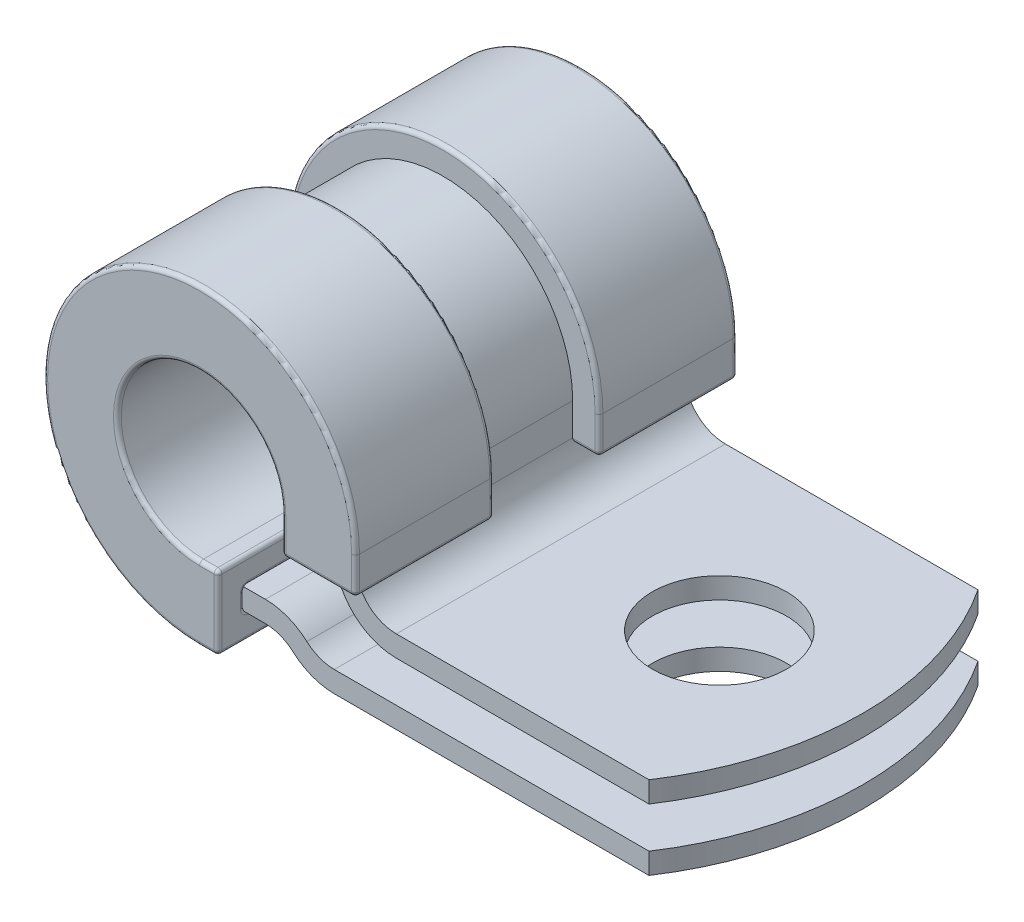
from build123d import *

# Parameters (mm, degrees)
BOSS_EXTRUDE1_DEPTH         = 6.35
FILLET3_R                   = 1.5748
FILLET2_R                   = 2.3876
SKETCH2_R                   = 2.5908
CUT_EXTRUDE1_DEPTH          = 21.22760381
CUT_EXTRUDE3_DEPTH          = 21.22760381
CUT_EXTRUDE3_DEPTH_BACK     = 21.22760381
BOSS_EXTRUDE2_DEPTH         = 7.366
BOSS_EXTRUDE2_DEPTH_BACK    = 7.366
BODY_MOVE_COPY1_START       = -6.0198
BODY_MOVE_COPY1_OUTLINE_R   = 2.5908
BODY_MOVE_COPY1_DEPTH       = 0.8128
BODY_MOVE_COPY1_START_2     = -1.2446
BODY_MOVE_COPY1_2_OUTLINE_W = 0.8128
BODY_MOVE_COPY1_2_OUTLINE_H = 12.7
BODY_MOVE_COPY1_2_DEPTH     = 1.2446
BODY_MOVE_COPY1_3_OUTLINE_R = 2.5908
BODY_MOVE_COPY1_3_DEPTH     = 4.191
BODY_MOVE_COPY1_START_3     = -3.6322
BODY_MOVE_COPY1_4_OUTLINE_R = 2.5908
BODY_MOVE_COPY1_4_DEPTH     = 2.3876
BODY_MOVE_COPY1_START_4     = -6.35
BODY_MOVE_COPY1_5_DEPTH     = 12.7
BODY_MOVE_COPY1_6_DEPTH     = 12.7
CUT_EXTRUDE4_DEPTH          = 2.032
CUT_EXTRUDE4_DEPTH_BACK     = 2.032
FILLET1_R                   = 0.1524


with BuildPart() as part:
    # Sketch8 → Boss-Extrude1 (new, symmetric)
    with BuildSketch(Plane.XY):
        with BuildLine():
            Line((18.2372, -5.207), (18.2372, -6.0198))
            Line((18.2372, -6.0198), (4.183126473, -6.0198))
            ThreePointArc((4.183126473, -6.0198), (3.326422666, -5.861708438), (2.582569456, -5.408258599))
            ThreePointArc((2.582569456, -5.408258599), (2.090603047, -5.108357912), (1.524, -5.0038))
            Line((1.524, -5.0038), (0, -5.0038))
            ThreePointArc((0, -5.0038), (-3.538220912, 3.538220912), (5.0038, 0))
            Line((5.0038, 0), (5.0038, -2.8194))
            Line((5.0038, -2.8194), (18.2372, -2.8194))
            Line((18.2372, -2.8194), (18.2372, -3.6322))
            Line((18.2372, -3.6322), (4.191, -3.6322))
            Line((4.191, -3.6322), (4.191, 0))
            ThreePointArc((4.191, 0), (-2.96348452, 2.96348452), (0, -4.191))
            Line((0, -4.191), (1.524, -4.191))
            ThreePointArc((1.524, -4.191), (2.380703807, -4.349091562), (3.124557017, -4.802541401))
            ThreePointArc((3.124557017, -4.802541401), (3.616523426, -5.102442088), (4.183126473, -5.207))
            Line((4.183126473, -5.207), (18.2372, -5.207))
        make_face()
    extrude(amount=BOSS_EXTRUDE1_DEPTH, both=True)

    # Fillet3
    fillet3_edges = [part.edges().sort_by_distance(p)[0] for p in [
        (5.0038, -2.8194, 0),
    ]]
    fillet(fillet3_edges, radius=FILLET3_R)

    # Fillet2
    fillet2_edges = [part.edges().sort_by_distance(p)[0] for p in [
        (4.191, -3.6322, 0),
    ]]
    fillet(fillet2_edges, radius=FILLET2_R)

    # Sketch2 → Cut-Extrude1 (cut, through all)
    with BuildSketch(Plane(origin=(0, 0, 0), x_dir=(1, 0, 0), z_dir=(0, 1, 0))):
        with Locations(Location((12.7, 0, 0), (0, 0, 270))):
            Circle(SKETCH2_R)
    extrude(amount=-CUT_EXTRUDE1_DEPTH, mode=Mode.SUBTRACT)

    # Sketch4 → Cut-Extrude3 (cut, two sides: drawn at the far end of the back side and taken through both)
    with BuildSketch(Plane(origin=(0, 0, 0), x_dir=(1, 0, 0), z_dir=(0, 1, 0)).offset(-CUT_EXTRUDE3_DEPTH_BACK)):
        with BuildLine():
            Line((-16.507856515, 56.157419047), (16.3322, 6.35))
            ThreePointArc((16.3322, 6.35), (18.2372, 0), (16.3322, -6.35))
            Line((16.3322, -6.35), (-16.507856515, -56.157419047))
            Line((-16.507856515, -56.157419047), (102.811015489, -56.157419047))
            Line((102.811015489, -56.157419047), (102.811015489, 56.157419047))
            Line((102.811015489, 56.157419047), (-16.507856515, 56.157419047))
        make_face()
    extrude(amount=CUT_EXTRUDE3_DEPTH + CUT_EXTRUDE3_DEPTH_BACK, mode=Mode.SUBTRACT)


with BuildPart() as body_2:
    # Sketch5 → Boss-Extrude2 (new, two sides: drawn at the far end of the back side and taken through both)
    with BuildSketch(Plane.XY.offset(-BOSS_EXTRUDE2_DEPTH_BACK)):
        with BuildLine():
            Line((3.175, 0), (3.175, -1.4097))
            Line((3.175, -1.4097), (6.0198, -1.4097))
            Line((6.0198, -1.4097), (6.0198, 0))
            ThreePointArc((6.0198, 0), (-4.256641401, 4.256641401), (0, -6.0198))
            Line((0, -6.0198), (0.7112, -6.0198))
            Line((0.7112, -6.0198), (0.7112, -3.175))
            Line((0.7112, -3.175), (0, -3.175))
            ThreePointArc((0, -3.175), (-2.24506403, 2.24506403), (3.175, 0))
        make_face()
    extrude(amount=BOSS_EXTRUDE2_DEPTH + BOSS_EXTRUDE2_DEPTH_BACK)

    # Combine1: cut part
    add(part.part, mode=Mode.SUBTRACT)

    # Sketch7 → Cut-Extrude4 (cut, two sides: drawn at the far end of the back side and taken through both)
    with BuildSketch(Plane.XY.offset(-CUT_EXTRUDE4_DEPTH_BACK)):
        with BuildLine():
            Line((1.524, -4.191), (1.524, -6.0198))
            Line((1.524, -6.0198), (0, -6.0198))
            ThreePointArc((0, -6.0198), (-4.256641401, 4.256641401), (6.0198, 0))
            Line((6.0198, 0), (6.0198, -1.4097))
            Line((6.0198, -1.4097), (4.191, -1.4097))
            Line((4.191, -1.4097), (4.191, 0))
            ThreePointArc((4.191, 0), (-2.96348452, 2.96348452), (0, -4.191))
            Line((0, -4.191), (1.524, -4.191))
        make_face()
    extrude(amount=CUT_EXTRUDE4_DEPTH + CUT_EXTRUDE4_DEPTH_BACK, mode=Mode.SUBTRACT)

    # Fillet1
    fillet1_edges = [body_2.edges().sort_by_distance(p)[0] for p in [
        (4.191, -1.4097, 0),
        (4.193857542, -1.4097, 2.032),
        (0.3556, -6.0198, 2.032),
        (0.7112, -5.5118, 2.032),
        (5.516139174, -1.4097, 2.032),
        (6.0198, -0.70485, 2.032),
        (-4.256641401, 4.256641401, 2.032),
        (4.193857542, -1.4097, -2.032),
        (0.3556, -6.0198, -2.032),
        (-4.256641401, 4.256641401, -2.032),
        (6.0198, -0.70485, -2.032),
        (5.516139174, -1.4097, -2.032),
        (0.7112, -5.5118, -2.032),
        (3.175, -1.4097, 0),
        (6.0198, -1.4097, 4.699),
        (-2.24506403, 2.24506403, -7.366),
        (0.3556, -3.175, -7.366),
        (0.7112, -4.5974, -7.366),
        (0.3556, -6.0198, -7.366),
        (-4.256641401, 4.256641401, -7.366),
        (6.0198, -0.70485, -7.366),
        (4.5974, -1.4097, -7.366),
        (3.175, -0.70485, -7.366),
        (0.7112, -6.0198, 4.699),
        (0.7112, -3.175, 0),
        (0.7112, -5.0038, 4.191),
        (0.7112, -4.5974, -6.35),
        (0.7112, -4.5974, 6.35),
        (0.3556, -3.175, 7.366),
        (0.7112, -4.191, 0),
        (4.196715085, -1.4097, -4.191),
        (-2.24506403, 2.24506403, 7.366),
        (5.012478348, -1.4097, -4.191),
        (3.175, -0.70485, 7.366),
        (4.192429199, -1.327199443, 6.35),
        (4.604596716, -1.4097, 6.35),
        (5.005971083, -1.327263964, 6.35),
        (5.0038, -0.6223, 6.35),
        (-3.538220912, 3.538220912, 6.35),
        (4.5974, -1.4097, 7.366),
        (0.3556, -5.0038, 6.35),
        (0.3556, -4.191, 6.35),
        (-2.96348452, 2.96348452, 6.35),
        (4.191, -0.6223, 6.35),
        (4.192429199, -1.327199443, -6.35),
        (6.0198, -0.70485, 7.366),
        (5.005971083, -1.327263964, -6.35),
        (4.604596716, -1.4097, -6.35),
        (0.3556, -4.191, -6.35),
        (0.3556, -5.0038, -6.35),
        (-4.256641401, 4.256641401, 7.366),
        (0.3556, -6.0198, 7.366),
        (0.7112, -4.5974, 7.366),
        (-2.96348452, 2.96348452, -6.35),
        (4.191, -0.6223, -6.35),
        (5.0038, -0.6223, -6.35),
        (-3.538220912, 3.538220912, -6.35),
        (0.7112, -5.0038, -4.191),
        (4.196715085, -1.4097, 4.191),
        (5.012478348, -1.4097, 4.191),
        (0.7112, -6.0198, -4.699),
        (6.0198, -1.4097, -4.699),
    ]]
    fillet(fillet1_edges, radius=FILLET1_R)


with BuildPart() as body_3:
    # Body-Move/Copy1: read off the stored shape, not the designer's step
    # Body-Move/Copy1 outline → Body-Move/Copy1 (new body)
    with BuildSketch(Plane(origin=(0, 0, 0), x_dir=(1, 0, 0), z_dir=(0, 1, 0)).offset(BODY_MOVE_COPY1_START)):
        with BuildLine():
            Line((4.191, 6.35), (4.191, -6.35))
            Line((4.191, -6.35), (16.3322, -6.35))
            ThreePointArc((16.3322, -6.35), (18.2372, 0), (16.3322, 6.35))
            Line((16.3322, 6.35), (4.191, 6.35))
        make_face()
        with Locations((12.7, 0)):
            Circle(BODY_MOVE_COPY1_OUTLINE_R, mode=Mode.SUBTRACT)
    extrude(amount=BODY_MOVE_COPY1_DEPTH)

    # Body-Move_Copy1 2 outline → Body-Move_Copy1 2 (add)
    with BuildSketch(Plane(origin=(0, 0, 0), x_dir=(1, 0, 0), z_dir=(0, 1, 0)).offset(BODY_MOVE_COPY1_START_2)):
        with Locations((4.5974, 0)):
            Rectangle(BODY_MOVE_COPY1_2_OUTLINE_W, BODY_MOVE_COPY1_2_OUTLINE_H)
    extrude(amount=BODY_MOVE_COPY1_2_DEPTH)

    # Body-Move_Copy1 3 outline → Body-Move_Copy1 3 (add)
    with BuildSketch(Plane(origin=(0, 0, 0), x_dir=(1, 0, 0), z_dir=(0, 1, 0))):
        with BuildLine():
            Line((4.191, 6.35), (4.191, -6.35))
            Line((4.191, -6.35), (16.3322, -6.35))
            ThreePointArc((16.3322, -6.35), (18.2372, 0), (16.3322, 6.35))
            Line((16.3322, 6.35), (4.191, 6.35))
        make_face()
        with Locations((12.7, 0)):
            Circle(BODY_MOVE_COPY1_3_OUTLINE_R, mode=Mode.SUBTRACT)
    extrude(amount=BODY_MOVE_COPY1_3_DEPTH)

    # Body-Move_Copy1 4 outline → Body-Move_Copy1 4 (add)
    with BuildSketch(Plane(origin=(0, 0, 0), x_dir=(1, 0, 0), z_dir=(0, 1, 0)).offset(BODY_MOVE_COPY1_START_3)):
        with BuildLine():
            Line((4.191, 6.35), (4.191, -6.35))
            Line((4.191, -6.35), (16.3322, -6.35))
            ThreePointArc((16.3322, -6.35), (18.2372, 0), (16.3322, 6.35))
            Line((16.3322, 6.35), (4.191, 6.35))
        make_face()
        with Locations((12.7, 0)):
            Circle(BODY_MOVE_COPY1_4_OUTLINE_R, mode=Mode.SUBTRACT)
    extrude(amount=BODY_MOVE_COPY1_4_DEPTH)

    # Body-Move_Copy1 5 outline → Body-Move_Copy1 5 (cut)
    with BuildSketch(Plane.XY.offset(BODY_MOVE_COPY1_START_4)):
        with BuildLine():
            ThreePointArc((5.0038, -1.2446), (5.465048241, -2.358151759), (6.5786, -2.8194))
            Line((6.5786, -2.8194), (20, -2.8194))
            Line((20, -2.8194), (20, -1.2446))
            Line((20, -1.2446), (5.0038, -1.2446))
        make_face()
        with BuildLine():
            Line((5.0038, 0), (20, 0))
            Line((20, 0), (20, 4.191))
            Line((20, 4.191), (4.191, 4.191))
            Line((4.191, 4.191), (4.191, 2.733776406))
            ThreePointArc((4.191, 2.733776406), (4.796297543, 1.426023955), (5.0038, 0))
        make_face()
        with BuildLine():
            Line((4.191, -3.6322), (6.5786, -3.6322))
            ThreePointArc((6.5786, -3.6322), (4.890311849, -2.932888151), (4.191, -1.2446))
            Line((4.191, -1.2446), (4.191, -3.6322))
        make_face()
    extrude(amount=BODY_MOVE_COPY1_5_DEPTH, mode=Mode.SUBTRACT)

    # Body-Move_Copy1 6 outline → Body-Move_Copy1 6 (add)
    with BuildSketch(Plane.XY.offset(BODY_MOVE_COPY1_START_4)):
        with BuildLine():
            Line((4.191, -6.0198), (4.191, -5.207))
            Line((4.191, -5.207), (4.183126473, -5.207))
            ThreePointArc((4.183126473, -5.207), (3.616523426, -5.102442088), (3.124557017, -4.802541401))
            ThreePointArc((3.124557017, -4.802541401), (2.380703807, -4.349091562), (1.524, -4.191))
            Line((1.524, -4.191), (0, -4.191))
            ThreePointArc((0, -4.191), (-2.96348452, 2.96348452), (4.191, 0))
            Line((4.191, 0), (4.191, 2.733776406))
            ThreePointArc((4.191, 2.733776406), (-4.399845726, 2.383143309), (0, -5.0038))
            Line((0, -5.0038), (1.524, -5.0038))
            ThreePointArc((1.524, -5.0038), (2.090603047, -5.108357912), (2.582569456, -5.408258599))
            ThreePointArc((2.582569456, -5.408258599), (3.326422666, -5.861708438), (4.183126473, -6.0198))
            Line((4.183126473, -6.0198), (4.191, -6.0198))
        make_face()
    extrude(amount=BODY_MOVE_COPY1_6_DEPTH)


solid = Compound([body_2.part, body_3.part])
